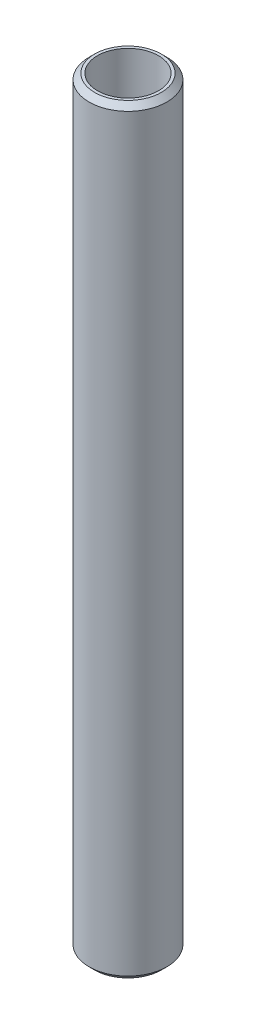
from build123d import *

# Parameters (mm, degrees)
SKETCH1_R           = 20
BOSS_EXTRUDE1_DEPTH = 390.958241653
SKETCH2_R           = 15.685670317
CUT_EXTRUDE1_DEPTH  = 392.980033568
CHAMFER1_SIZE       = 2.853447574


with BuildPart() as part:
    # Sketch1 → Boss-Extrude1 (new body)
    with BuildSketch(Plane(origin=(0, 0, 0), x_dir=(1, 0, 0), z_dir=(0, 1, 0))):
        Circle(SKETCH1_R)
    extrude(amount=BOSS_EXTRUDE1_DEPTH)

    # Sketch2 → Cut-Extrude1 (cut, through all)
    with BuildSketch(Plane(origin=(0, 0, 0), x_dir=(1, 0, 0), z_dir=(0, 1, 0))):
        Circle(SKETCH2_R)
    extrude(amount=CUT_EXTRUDE1_DEPTH, mode=Mode.SUBTRACT)

    # Chamfer1
    chamfer1_edges = [part.edges().sort_by_distance(p)[0] for p in [
        (-20, 390.958241653, 0),
        (-20, 0, 0),
    ]]
    chamfer(chamfer1_edges, length=CHAMFER1_SIZE)


solid = part.part
